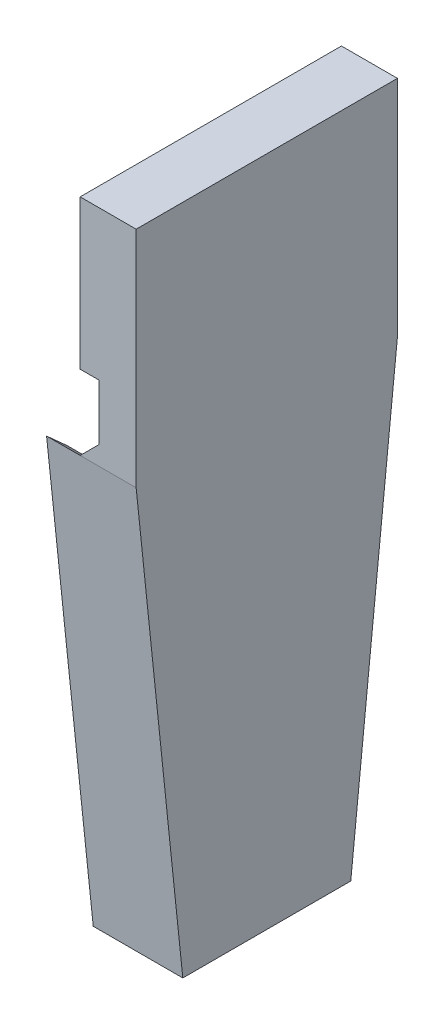
from build123d import *

# Parameters (mm, degrees)
EXTRUDE_1_DEPTH          = 2.5
EXTRUDE_1_DEPTH_BACK     = 2.5
SKETCH_1_R               = 2
EXTRUDE_2_DEPTH          = 3
SKETCH_4_W               = 5
SKETCH_4_H               = 21
EXTRUDE_3_DEPTH          = 1.8
CUT_EXTRUDE_1_DEPTH      = 72.103790411
CUT_EXTRUDE_1_DEPTH_BACK = 72.103790411
SHELL_START              = 62.288432405
SHELL_1_DEPTH            = 2
SHELL_START_2            = 63.288432405
SHELL_1_2_OUTLINE_W      = 1
SHELL_1_2_OUTLINE_H      = 12
SHELL_1_2_DEPTH          = 1
EXTRUDE_4_DEPTH          = 1
EXTRUDE_5_DEPTH          = 1.8


with BuildPart() as part:
    # 草图1 → 凸台-拉伸1 (new, two sides: drawn at the far end of the back side and taken through both)
    # profile 1 of 2: a face of its own
    with BuildSketch(Plane.XY.offset(-EXTRUDE_1_DEPTH_BACK)):
        with Locations((54.288432405, 0.720527774)):
            Circle(SKETCH_1_R)
    # profile 2 of 2: a face of its own
    with BuildSketch(Plane.XY.offset(-EXTRUDE_1_DEPTH_BACK)):
        Polygon((54.288432405, 0.720527774), (62.288432405, 0.720527774), (62.288432405, -13.279472226), (62.288432405, -21.279472226), (54.288432405, -13.279472226), align=None)
        Polygon((56.288432405, -12.451045101), (60.288432405, -16.451045101), (60.288432405, -13.279472226), (60.288432405, -1.279472226), (56.288432405, -5.279472226), align=None, mode=Mode.SUBTRACT)
    extrude(amount=EXTRUDE_1_DEPTH + EXTRUDE_1_DEPTH_BACK)

    # 草图2 → 凸台-拉伸2 (add)
    with BuildSketch(Plane(origin=(62.288432405, 0, 0), x_dir=(0, 0, -1), z_dir=(1, 0, 0))):
        Polygon((-7, -3.279472226), (-4.5, -27.279472226), (4.5, -27.279472226), (7, -3.279472226), (7, 8.720527774), (-7, 8.720527774), align=None)
    extrude(amount=EXTRUDE_2_DEPTH)

    # 草图4 → 凸台-拉伸3 (add)
    with BuildSketch(Plane.ZY.offset(-62.288432405)):
        Polygon((-2.5, -0.279472226), (-7, -0.279472226), (-7, -3.279472226), (-4.5, -27.279472226), (4.5, -27.279472226), (7, -3.279472226), (7, -0.279472226), (2.5, -0.279472226), (2.5, -21.279472226), (-2.5, -21.279472226), align=None)
        with Locations((0, -10.779472226)):
            Rectangle(SKETCH_4_W, SKETCH_4_H)
    extrude(amount=EXTRUDE_3_DEPTH)

    # 草图5 → 切除-拉伸1 (cut, two sides: drawn at the far end of the back side and taken through both)
    with BuildSketch(Plane.XY.offset(-CUT_EXTRUDE_1_DEPTH_BACK)):
        Polygon((47.883968073, 6.720527774), (47.883968073, -27.279472226), (62.288432405, -27.279472226), (62.288432405, -3.279472226), (63.288432405, -2.279472226), (63.288432405, 6.720527774), (62.288432405, 6.720527774), align=None)
    extrude(amount=CUT_EXTRUDE_1_DEPTH + CUT_EXTRUDE_1_DEPTH_BACK, mode=Mode.SUBTRACT)

    # 抽壳1: read off the stored shape, not the designer's step
    # 抽壳1 outline → 抽壳1 (cut)
    with BuildSketch(Plane.YZ.offset(SHELL_START)):
        Polygon((6.720527774, -6), (6.720527774, 6), (-3.227529416, 6), (-26.279472226, 3.598755957), (-26.279472226, -3.598755957), (-3.227529416, -6), align=None)
    extrude(amount=SHELL_1_DEPTH, mode=Mode.SUBTRACT)

    # Shell 1 2 outline → Shell 1 2 (cut)
    with BuildSketch(Plane.YZ.offset(SHELL_START_2)):
        with Locations((7.220527774, 0)):
            Rectangle(SHELL_1_2_OUTLINE_W, SHELL_1_2_OUTLINE_H)
    extrude(amount=SHELL_1_2_DEPTH, mode=Mode.SUBTRACT)

    # 草图7 → 凸台-拉伸4 (add)
    with BuildSketch(Plane.ZY.offset(-63.288432405)):
        Polygon((-6, 4.720527774), (-6, 6.720527774), (-7, 6.720527774), (-7, 0.720527774), align=None)
        Polygon((6, 4.720527774), (7, 0.720527774), (7, 6.720527774), (6, 6.720527774), align=None)
    extrude(amount=EXTRUDE_4_DEPTH)

    # 草图6 → 凸台-拉伸5 (add)
    with BuildSketch(Plane.ZY.offset(-62.288432405)):
        Polygon((3.598755957, -26.279472226), (5.890422624, -4.279472226), (7, -3.279472226), (4.5, -27.279472226), (-4.5, -27.279472226), (-7, -3.279472226), (-5.890422624, -4.279472226), (-3.598755957, -26.279472226), align=None)
    extrude(amount=EXTRUDE_5_DEPTH)


solid = part.part
